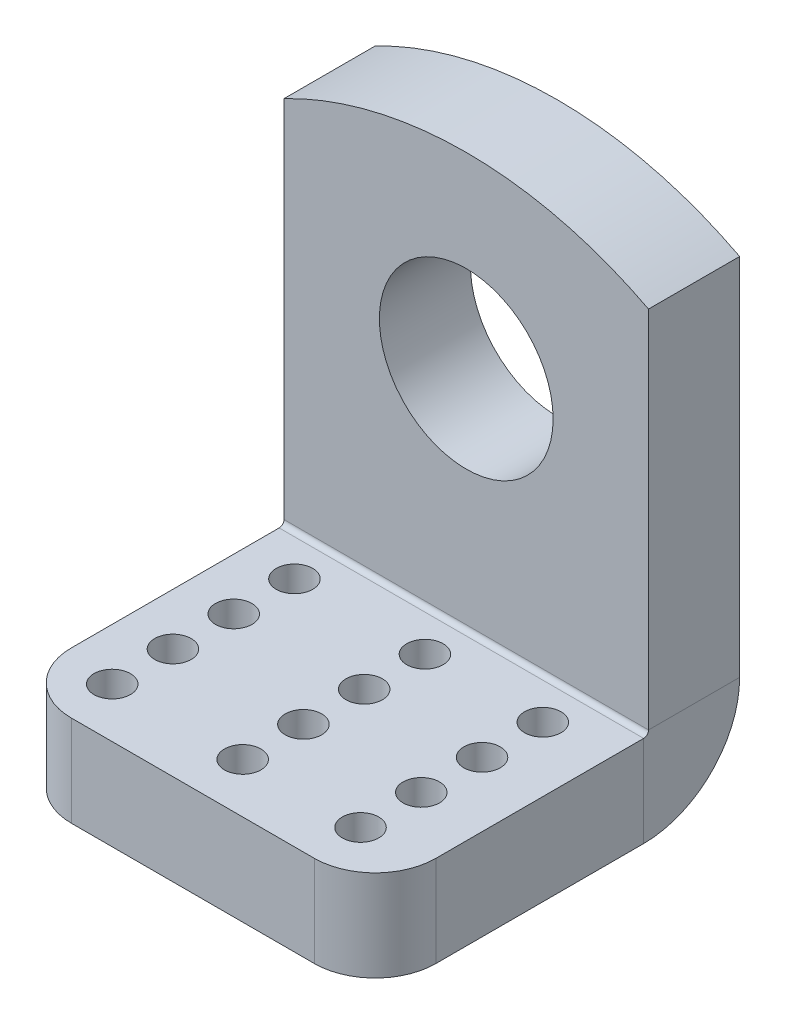
from build123d import *

# Parameters (mm, degrees)
SKETCH1_R          = 14.3
BASE_FLANGE1_DEPTH = 15
EDGE_FLANGE1_DEPTH = 60
SKETCH9_R          = 3
CUT_EXTRUDE1_DEPTH = 50
FILLET1_R          = 10


# Sheet-metal steps are written as plain solids
with BuildPart() as part:
    # Sketch1 → Base-Flange1 (new body)
    with BuildSketch(Plane.XY):
        with BuildLine():
            Line((-30, 0), (30, 0))
            Line((30, 0), (30, 60))
            ThreePointArc((30, 60), (0, 67.337187027), (-30, 60))
            Line((-30, 60), (-30, 0))
        make_face()
        with Locations((0, 36.48)):
            Circle(SKETCH1_R, mode=Mode.SUBTRACT)
    extrude(amount=-BASE_FLANGE1_DEPTH)

    # Edge-Flange1 section (across the edge) → Edge-Flange1 (add)
    with BuildSketch(Plane(origin=(-30, -0.8, 0), x_dir=(0, 1, 0), z_dir=(1, 0, 0))):
        with BuildLine():
            Line((-15, 0.8), (-15, 45))
            Line((-15, 45), (0, 45))
            Line((0, 45), (0, 0.8))
            ThreePointArc((0, 0.8), (0.234314575, 0.234314575), (0.8, 0))
            Line((0.8, 0), (0.8, -15))
            ThreePointArc((0.8, -15), (-10.372287143, -10.372287143), (-15, 0.8))
        make_face()
    extrude(amount=EDGE_FLANGE1_DEPTH)

    # Sketch9 → Cut-Extrude1 (cut)
    with BuildSketch(Plane(origin=(0, -0.8, 0), x_dir=(1, 0, 0), z_dir=(0, 1, 0))):
        with Locations(Location((-21.478093951, -6.800727635, 0), (0, 0, 270))):
            Circle(SKETCH9_R)
        with Locations(Location((19.398278521, -6.800727635, 0), (0, 0, 270))):
            Circle(SKETCH9_R)
        with Locations(Location((0, -6.800727635, 0), (0, 0, 270))):
            Circle(SKETCH9_R)
        with Locations(Location((-21.478093951, -16.800727635, 0), (0, 0, 270))):
            Circle(SKETCH9_R)
        with Locations(Location((-21.478093951, -26.800727635, 0), (0, 0, 270))):
            Circle(SKETCH9_R)
        with Locations(Location((-21.478093951, -36.800727635, 0), (0, 0, 270))):
            Circle(SKETCH9_R)
        with Locations(Location((0, -16.800727635, 0), (0, 0, 270))):
            Circle(SKETCH9_R)
        with Locations(Location((0, -26.800727635, 0), (0, 0, 270))):
            Circle(SKETCH9_R)
        with Locations(Location((0, -36.800727635, 0), (0, 0, 270))):
            Circle(SKETCH9_R)
        with Locations(Location((19.398278521, -16.800727635, 0), (0, 0, 270))):
            Circle(SKETCH9_R)
        with Locations(Location((19.398278521, -26.800727635, 0), (0, 0, 270))):
            Circle(SKETCH9_R)
        with Locations(Location((19.398278521, -36.800727635, 0), (0, 0, 270))):
            Circle(SKETCH9_R)
    extrude(amount=-CUT_EXTRUDE1_DEPTH, mode=Mode.SUBTRACT)

    # Fillet1
    fillet1_edges = [part.edges().sort_by_distance(p)[0] for p in [
        (-30, -8.3, 45),
        (30, -8.3, 45),
    ]]
    fillet(fillet1_edges, radius=FILLET1_R)


solid = part.part
